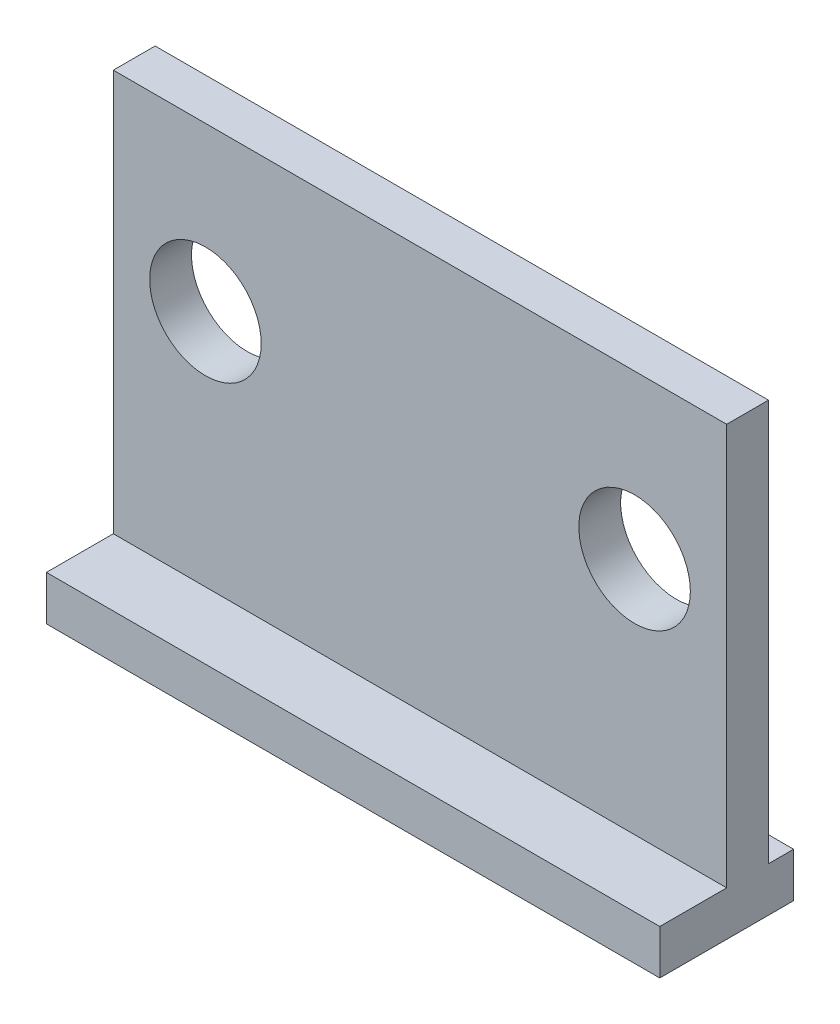
from build123d import *

# Parameters (mm, degrees)
SKETCH1_W                = 110
SKETCH1_H                = 80
SKETCH1_R                = 10
BOSS_EXTRUDE1_DEPTH      = 7.5
BOSS_EXTRUDE2_DEPTH      = 12
BOSS_EXTRUDE2_DEPTH_BACK = 12
SKETCH3_W                = 110
SKETCH3_H                = 8


with BuildPart() as part:
    # Sketch1 → Boss-Extrude1 (new body)
    with BuildSketch(Plane.XY):
        with Locations((0, 40)):
            Rectangle(SKETCH1_W, SKETCH1_H)
        with Locations((-38.481, 50.8)):
            Circle(SKETCH1_R, mode=Mode.SUBTRACT)
        with BuildLine():
            ThreePointArc((28.481, 50.8), (38.481, 60.8), (48.481, 50.8))
            ThreePointArc((48.481, 50.8), (38.481, 40.8), (28.481, 50.8))
        make_face(mode=Mode.SUBTRACT)
    extrude(amount=BOSS_EXTRUDE1_DEPTH)

    # Sketch3 → Boss-Extrude2 (add, two sides: drawn at the far end of the back side and taken through both)
    with BuildSketch(Plane.XY.offset(7.5).offset(-BOSS_EXTRUDE2_DEPTH_BACK)):
        with Locations((0, 4)):
            Rectangle(SKETCH3_W, SKETCH3_H)
    extrude(amount=BOSS_EXTRUDE2_DEPTH + BOSS_EXTRUDE2_DEPTH_BACK)


solid = part.part
